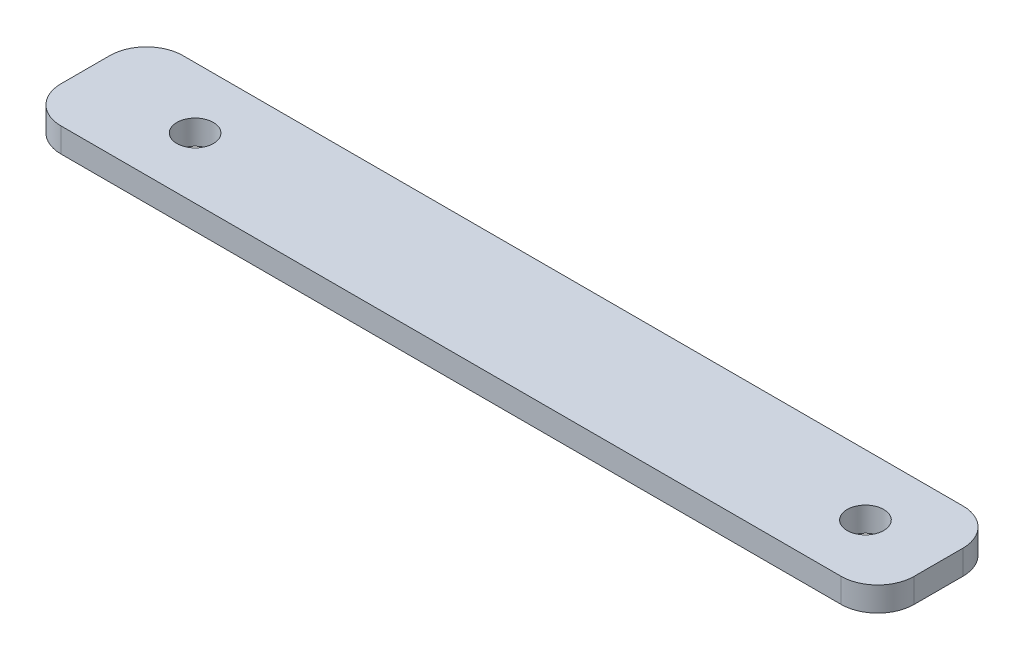
from build123d import *

# Parameters (mm, degrees)
SKETCH1_W             = 70
SKETCH1_H             = 10
BOSS_EXTRUDE1_DEPTH   = 2
FILLET1_R             = 3
F_3_0MM_DOWEL_HOLE1_D = 3


with BuildPart() as part:
    # Sketch1 → Boss-Extrude1 (new body)
    with BuildSketch(Plane(origin=(0, 0, 0), x_dir=(1, 0, 0), z_dir=(0, 1, 0))):
        Rectangle(SKETCH1_W, SKETCH1_H)
    extrude(amount=BOSS_EXTRUDE1_DEPTH)

    # Fillet1
    fillet1_edges = [part.edges().sort_by_distance(p)[0] for p in [
        (35, 1, 5),
        (35, 1, -5),
        (-35, 1, 5),
        (-35, 1, -5),
    ]]
    fillet(fillet1_edges, radius=FILLET1_R)

    # Ø3.0mm Dowel Hole1 (through all)
    with Locations(Plane(origin=(0, 0, 0), x_dir=(-1, 0, 0), z_dir=(0, -1, 0))):
        with Locations((-29, 0), (26, 0)):
            Hole(F_3_0MM_DOWEL_HOLE1_D / 2)


solid = part.part
